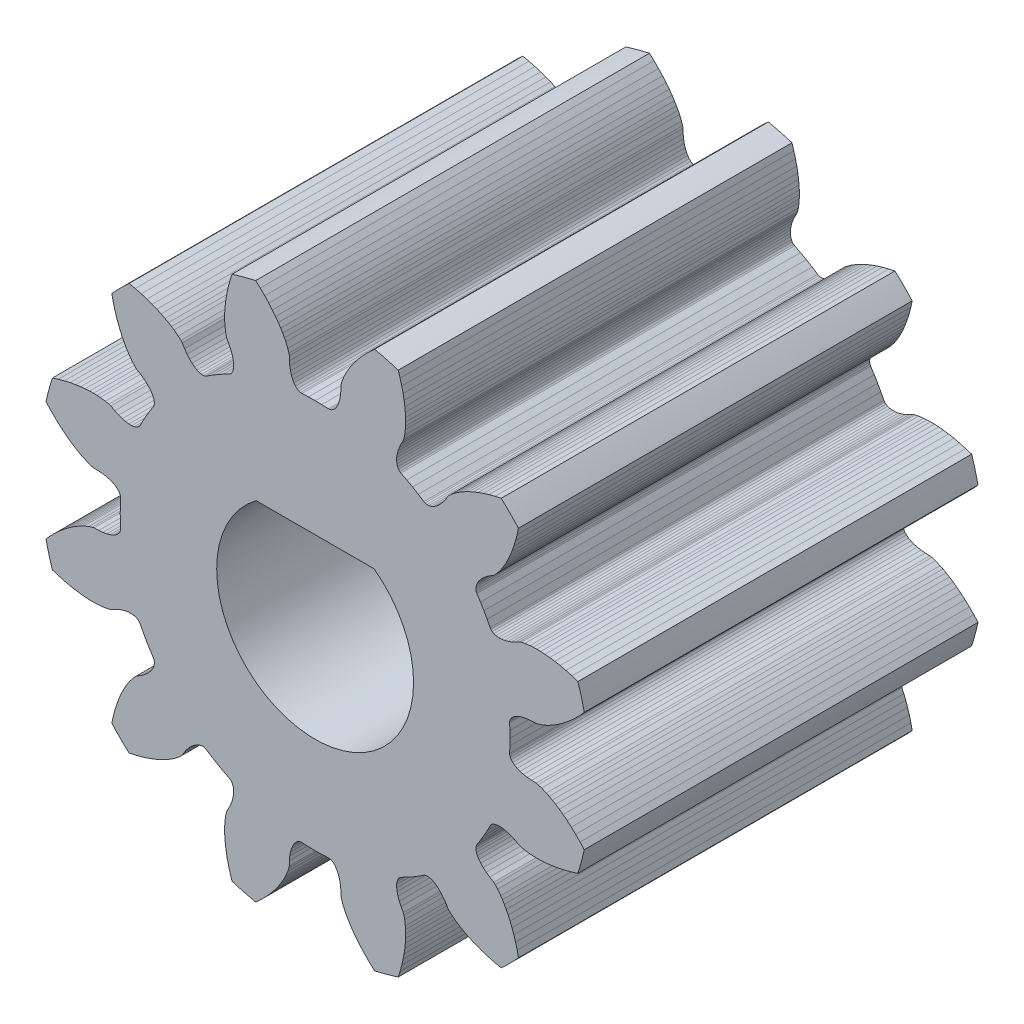
from build123d import *

# Parameters (mm, degrees)
BOSS_EXTRUDE1_DEPTH = 10
SKETCH3_R           = 2.5
CUT_EXTRUDE1_DEPTH  = 40.726722656
SKETCH4_W           = 5.915822746
SKETCH4_H           = 1.691857177
BOSS_EXTRUDE2_DEPTH = 10


with BuildPart() as part:
    # Model → Boss-Extrude1 (new body)
    with BuildSketch(Plane.XY):
        with BuildLine():
            Line((25.8693845, -4.5708333), (25.9097848, -4.4160686))
            Line((25.9097848, -4.4160686), (25.953786, -4.2724809))
            Line((25.953786, -4.2724809), (26.0002786, -4.1407685))
            Line((26.0002786, -4.1407685), (26.0487652, -4.0198098))
            Line((26.0487652, -4.0198098), (26.0976506, -3.9112417))
            Line((26.0976506, -3.9112417), (26.1474591, -3.8119326))
            Line((26.1474591, -3.8119326), (26.1956452, -3.7251533))
            Line((26.1956452, -3.7251533), (26.2429181, -3.6477925))
            Line((26.2429181, -3.6477925), (26.2874834, -3.5813018))
            Line((26.2874834, -3.5813018), (26.3670654, -3.4769619))
            Line((26.3670654, -3.4769619), (26.4284965, -3.4089436))
            Line((26.4284965, -3.4089436), (26.4660329, -3.3745587))
            Line((26.4660329, -3.3745587), (26.5668109, -3.3141113))
            Line((26.5668109, -3.3141113), (26.6546587, -3.2515682))
            Line((26.6546587, -3.2515682), (26.7295821, -3.1879192))
            Line((26.7295821, -3.1879192), (26.7916695, -3.1241177))
            Line((26.7916695, -3.1241177), (26.8410468, -3.0611418))
            Line((26.8410468, -3.0611418), (26.8779217, -2.999911))
            Line((26.8779217, -2.999911), (26.9025353, -2.9413829))
            Line((26.9025353, -2.9413829), (26.9152053, -2.8864481))
            Line((26.9152053, -2.8864481), (26.9162819, -2.8360127))
            Line((26.9162819, -2.8360127), (26.906188, -2.7909297))
            Line((26.906188, -2.7909297), (26.8915643, -2.7611406))
            Line((26.8915643, -2.7611406), (26.8003034, -2.6201521))
            Line((26.8003034, -2.6201521), (26.7131743, -2.475))
            Line((26.7131743, -2.475), (26.6310334, -2.3269679))
            Line((26.6310334, -2.3269679), (26.5545643, -2.1774394))
            Line((26.5545643, -2.1774394), (26.536078, -2.1498803))
            Line((26.536078, -2.1498803), (26.5020819, -2.1185973))
            Line((26.5020819, -2.1185973), (26.4578653, -2.0943119))
            Line((26.4578653, -2.0943119), (26.4039553, -2.0778171))
            Line((26.4039553, -2.0778171), (26.3409617, -2.069869))
            Line((26.3409617, -2.069869), (26.2694968, -2.0711882))
            Line((26.2694968, -2.0711882), (26.1902695, -2.0824623))
            Line((26.1902695, -2.0824623), (26.1039721, -2.1043308))
            Line((26.1039721, -2.1043308), (26.0113887, -2.1373918))
            Line((26.0113887, -2.1373918), (25.9133009, -2.1821987))
            Line((25.9133009, -2.1821987), (25.8105629, -2.2392513))
            Line((25.8105629, -2.2392513), (25.7620165, -2.2545664))
            Line((25.7620165, -2.2545664), (25.6723954, -2.2737581))
            Line((25.6723954, -2.2737581), (25.5422434, -2.2905082))
            Line((25.5422434, -2.2905082), (25.4623781, -2.2958575))
            Line((25.4623781, -2.2958575), (25.3717452, -2.2981167))
            Line((25.3717452, -2.2981167), (25.2724991, -2.2964574))
            Line((25.2724991, -2.2964574), (25.1615906, -2.2899383))
            Line((25.1615906, -2.2899383), (25.0431252, -2.2779902))
            Line((25.0431252, -2.2779902), (24.9141286, -2.2595015))
            Line((24.9141286, -2.2595015), (24.776816, -2.2339091))
            Line((24.776816, -2.2339091), (24.6304648, -2.2002214))
            Line((24.6304648, -2.2002214), (24.4762345, -2.1578267))
            Line((24.4762345, -2.1578267), (24.325472271, -2.109558904))
            ThreePointArc((24.325472271, -2.109558904), (24.23854966, -1.811725181), (24.164909974, -1.510332309))
            Line((24.164909974, -1.510332309), (24.27134, -1.39315))
            Line((24.27134, -1.39315), (24.38371, -1.27932))
            Line((24.38371, -1.27932), (24.49361, -1.17697))
            Line((24.49361, -1.17697), (24.59973, -1.08615))
            Line((24.59973, -1.08615), (24.7022, -1.00564))
            Line((24.7022, -1.00564), (24.79882, -0.93606))
            Line((24.79882, -0.93606), (24.89161, -0.87496))
            Line((24.89161, -0.87496), (24.97673, -0.8239))
            Line((24.97673, -0.8239), (25.05635, -0.78054))
            Line((25.05635, -0.78054), (25.12819, -0.74524))
            Line((25.12819, -0.74524), (25.24928, -0.69467))
            Line((25.24928, -0.69467), (25.33649, -0.66648))
            Line((25.33649, -0.66648), (25.38619, -0.65547))
            Line((25.38619, -0.65547), (25.50369, -0.65351))
            Line((25.50369, -0.65351), (25.61104, -0.64327))
            Line((25.61104, -0.64327), (25.70775, -0.62561))
            Line((25.70775, -0.62561), (25.79342, -0.6014))
            Line((25.79342, -0.6014), (25.86767, -0.57155))
            Line((25.86767, -0.57155), (25.93022, -0.53696))
            Line((25.93022, -0.53696), (25.9808, -0.49858))
            Line((25.9808, -0.49858), (26.01924, -0.45734))
            Line((26.01924, -0.45734), (26.04539, -0.4142))
            Line((26.04539, -0.4142), (26.05919, -0.37011))
            Line((26.05919, -0.37011), (26.06142, -0.337))
            Line((26.06142, -0.337), (26.05288, -0.16927))
            Line((26.05288, -0.16927), (26.05, 0))
            Line((26.05, 0), (26.05288, 0.16927))
            Line((26.05288, 0.16927), (26.06142, 0.337))
            Line((26.06142, 0.337), (26.05919, 0.37011))
            Line((26.05919, 0.37011), (26.04539, 0.4142))
            Line((26.04539, 0.4142), (26.01924, 0.45734))
            Line((26.01924, 0.45734), (25.9808, 0.49858))
            Line((25.9808, 0.49858), (25.93022, 0.53696))
            Line((25.93022, 0.53696), (25.86767, 0.57155))
            Line((25.86767, 0.57155), (25.79342, 0.6014))
            Line((25.79342, 0.6014), (25.70775, 0.62561))
            Line((25.70775, 0.62561), (25.61104, 0.64327))
            Line((25.61104, 0.64327), (25.50369, 0.65351))
            Line((25.50369, 0.65351), (25.38619, 0.65547))
            Line((25.38619, 0.65547), (25.33649, 0.66648))
            Line((25.33649, 0.66648), (25.24928, 0.69467))
            Line((25.24928, 0.69467), (25.12819, 0.74524))
            Line((25.12819, 0.74524), (25.05635, 0.78054))
            Line((25.05635, 0.78054), (24.97673, 0.8239))
            Line((24.97673, 0.8239), (24.89161, 0.87496))
            Line((24.89161, 0.87496), (24.79882, 0.93606))
            Line((24.79882, 0.93606), (24.7022, 1.00564))
            Line((24.7022, 1.00564), (24.59973, 1.08615))
            Line((24.59973, 1.08615), (24.49361, 1.17697))
            Line((24.49361, 1.17697), (24.38371, 1.27932))
            Line((24.38371, 1.27932), (24.27134, 1.39315))
            Line((24.27134, 1.39315), (24.164909974, 1.510332309))
            ThreePointArc((24.164909974, 1.510332309), (24.23854966, 1.811725181), (24.325472271, 2.109558904))
            Line((24.325472271, 2.109558904), (24.4762345, 2.1578267))
            Line((24.4762345, 2.1578267), (24.6304648, 2.2002214))
            Line((24.6304648, 2.2002214), (24.776816, 2.2339091))
            Line((24.776816, 2.2339091), (24.9141286, 2.2595015))
            Line((24.9141286, 2.2595015), (25.0431252, 2.2779902))
            Line((25.0431252, 2.2779902), (25.1615906, 2.2899383))
            Line((25.1615906, 2.2899383), (25.2724991, 2.2964574))
            Line((25.2724991, 2.2964574), (25.3717452, 2.2981167))
            Line((25.3717452, 2.2981167), (25.4623781, 2.2958575))
            Line((25.4623781, 2.2958575), (25.5422434, 2.2905082))
            Line((25.5422434, 2.2905082), (25.6723954, 2.2737581))
            Line((25.6723954, 2.2737581), (25.7620165, 2.2545664))
            Line((25.7620165, 2.2545664), (25.8105629, 2.2392513))
            Line((25.8105629, 2.2392513), (25.9133009, 2.1821987))
            Line((25.9133009, 2.1821987), (26.0113887, 2.1373918))
            Line((26.0113887, 2.1373918), (26.1039721, 2.1043308))
            Line((26.1039721, 2.1043308), (26.1902695, 2.0824623))
            Line((26.1902695, 2.0824623), (26.2694968, 2.0711882))
            Line((26.2694968, 2.0711882), (26.3409617, 2.069869))
            Line((26.3409617, 2.069869), (26.4039553, 2.0778171))
            Line((26.4039553, 2.0778171), (26.4578653, 2.0943119))
            Line((26.4578653, 2.0943119), (26.5020819, 2.1185973))
            Line((26.5020819, 2.1185973), (26.536078, 2.1498803))
            Line((26.536078, 2.1498803), (26.5545643, 2.1774394))
            Line((26.5545643, 2.1774394), (26.6310334, 2.3269679))
            Line((26.6310334, 2.3269679), (26.7131743, 2.475))
            Line((26.7131743, 2.475), (26.8003034, 2.6201521))
            Line((26.8003034, 2.6201521), (26.8915643, 2.7611406))
            Line((26.8915643, 2.7611406), (26.906188, 2.7909297))
            Line((26.906188, 2.7909297), (26.9162819, 2.8360127))
            Line((26.9162819, 2.8360127), (26.9152053, 2.8864481))
            Line((26.9152053, 2.8864481), (26.9025353, 2.9413829))
            Line((26.9025353, 2.9413829), (26.8779217, 2.999911))
            Line((26.8779217, 2.999911), (26.8410468, 3.0611418))
            Line((26.8410468, 3.0611418), (26.7916695, 3.1241177))
            Line((26.7916695, 3.1241177), (26.7295821, 3.1879192))
            Line((26.7295821, 3.1879192), (26.6546587, 3.2515682))
            Line((26.6546587, 3.2515682), (26.5668109, 3.3141113))
            Line((26.5668109, 3.3141113), (26.4660329, 3.3745587))
            Line((26.4660329, 3.3745587), (26.4284965, 3.4089436))
            Line((26.4284965, 3.4089436), (26.3670654, 3.4769619))
            Line((26.3670654, 3.4769619), (26.2874834, 3.5813018))
            Line((26.2874834, 3.5813018), (26.2429181, 3.6477925))
            Line((26.2429181, 3.6477925), (26.1956452, 3.7251533))
            Line((26.1956452, 3.7251533), (26.1474591, 3.8119326))
            Line((26.1474591, 3.8119326), (26.0976506, 3.9112417))
            Line((26.0976506, 3.9112417), (26.0487652, 4.0198098))
            Line((26.0487652, 4.0198098), (26.0002786, 4.1407685))
            Line((26.0002786, 4.1407685), (25.953786, 4.2724809))
            Line((25.953786, 4.2724809), (25.9097848, 4.4160686))
            Line((25.9097848, 4.4160686), (25.8693845, 4.5708333))
            Line((25.8693845, 4.5708333), (25.83580457, 4.725531132))
            ThreePointArc((25.83580457, 4.725531132), (26.050274832, 4.949725168), (26.274468868, 5.16419543))
            Line((26.274468868, 5.16419543), (26.4291667, 5.1306155))
            Line((26.4291667, 5.1306155), (26.5839314, 5.0902152))
            Line((26.5839314, 5.0902152), (26.7275191, 5.046214))
            Line((26.7275191, 5.046214), (26.8592315, 4.9997214))
            Line((26.8592315, 4.9997214), (26.9801902, 4.9512348))
            Line((26.9801902, 4.9512348), (27.0887583, 4.9023494))
            Line((27.0887583, 4.9023494), (27.1880674, 4.8525409))
            Line((27.1880674, 4.8525409), (27.2748467, 4.8043548))
            Line((27.2748467, 4.8043548), (27.3522075, 4.7570819))
            Line((27.3522075, 4.7570819), (27.4186982, 4.7125166))
            Line((27.4186982, 4.7125166), (27.5230381, 4.6329346))
            Line((27.5230381, 4.6329346), (27.5910564, 4.5715035))
            Line((27.5910564, 4.5715035), (27.6254413, 4.5339671))
            Line((27.6254413, 4.5339671), (27.6858887, 4.4331891))
            Line((27.6858887, 4.4331891), (27.7484318, 4.3453413))
            Line((27.7484318, 4.3453413), (27.8120808, 4.2704179))
            Line((27.8120808, 4.2704179), (27.8758823, 4.2083305))
            Line((27.8758823, 4.2083305), (27.9388582, 4.1589532))
            Line((27.9388582, 4.1589532), (28.000089, 4.1220783))
            Line((28.000089, 4.1220783), (28.0586171, 4.0974647))
            Line((28.0586171, 4.0974647), (28.1135519, 4.0847947))
            Line((28.1135519, 4.0847947), (28.1639873, 4.0837181))
            Line((28.1639873, 4.0837181), (28.2090703, 4.093812))
            Line((28.2090703, 4.093812), (28.2388594, 4.1084357))
            Line((28.2388594, 4.1084357), (28.3798479, 4.1996966))
            Line((28.3798479, 4.1996966), (28.525, 4.2868257))
            Line((28.525, 4.2868257), (28.6730321, 4.3689666))
            Line((28.6730321, 4.3689666), (28.8225606, 4.4454357))
            Line((28.8225606, 4.4454357), (28.8501197, 4.463922))
            Line((28.8501197, 4.463922), (28.8814027, 4.4979181))
            Line((28.8814027, 4.4979181), (28.9056881, 4.5421347))
            Line((28.9056881, 4.5421347), (28.9221829, 4.5960447))
            Line((28.9221829, 4.5960447), (28.930131, 4.6590383))
            Line((28.930131, 4.6590383), (28.9288118, 4.7305032))
            Line((28.9288118, 4.7305032), (28.9175377, 4.8097305))
            Line((28.9175377, 4.8097305), (28.8956692, 4.8960279))
            Line((28.8956692, 4.8960279), (28.8626082, 4.9886113))
            Line((28.8626082, 4.9886113), (28.8178013, 5.0866991))
            Line((28.8178013, 5.0866991), (28.7607487, 5.1894371))
            Line((28.7607487, 5.1894371), (28.7454336, 5.2379835))
            Line((28.7454336, 5.2379835), (28.7262419, 5.3276046))
            Line((28.7262419, 5.3276046), (28.7094918, 5.4577566))
            Line((28.7094918, 5.4577566), (28.7041425, 5.5376219))
            Line((28.7041425, 5.5376219), (28.7018833, 5.6282548))
            Line((28.7018833, 5.6282548), (28.7035426, 5.7275009))
            Line((28.7035426, 5.7275009), (28.7100617, 5.8384094))
            Line((28.7100617, 5.8384094), (28.7220098, 5.9568748))
            Line((28.7220098, 5.9568748), (28.7404985, 6.0858714))
            Line((28.7404985, 6.0858714), (28.7660909, 6.223184))
            Line((28.7660909, 6.223184), (28.7997786, 6.3695352))
            Line((28.7997786, 6.3695352), (28.8421733, 6.5237655))
            Line((28.8421733, 6.5237655), (28.890441096, 6.674527729))
            ThreePointArc((28.890441096, 6.674527729), (29.188274819, 6.76145034), (29.489667691, 6.835090026))
            Line((29.489667691, 6.835090026), (29.60685, 6.72866))
            Line((29.60685, 6.72866), (29.72068, 6.61629))
            Line((29.72068, 6.61629), (29.82303, 6.50639))
            Line((29.82303, 6.50639), (29.91385, 6.40027))
            Line((29.91385, 6.40027), (29.99436, 6.2978))
            Line((29.99436, 6.2978), (30.06394, 6.20118))
            Line((30.06394, 6.20118), (30.12504, 6.10839))
            Line((30.12504, 6.10839), (30.1761, 6.02327))
            Line((30.1761, 6.02327), (30.21946, 5.94365))
            Line((30.21946, 5.94365), (30.25476, 5.87181))
            Line((30.25476, 5.87181), (30.30533, 5.75072))
            Line((30.30533, 5.75072), (30.33352, 5.66351))
            Line((30.33352, 5.66351), (30.34453, 5.61381))
            Line((30.34453, 5.61381), (30.34649, 5.49631))
            Line((30.34649, 5.49631), (30.35673, 5.38896))
            Line((30.35673, 5.38896), (30.37439, 5.29225))
            Line((30.37439, 5.29225), (30.3986, 5.20658))
            Line((30.3986, 5.20658), (30.42845, 5.13233))
            Line((30.42845, 5.13233), (30.46304, 5.06978))
            Line((30.46304, 5.06978), (30.50142, 5.0192))
            Line((30.50142, 5.0192), (30.54266, 4.98076))
            Line((30.54266, 4.98076), (30.5858, 4.95461))
            Line((30.5858, 4.95461), (30.62989, 4.94081))
            Line((30.62989, 4.94081), (30.663, 4.93858))
            Line((30.663, 4.93858), (30.83073, 4.94712))
            Line((30.83073, 4.94712), (31, 4.95))
            Line((31, 4.95), (31.16927, 4.94712))
            Line((31.16927, 4.94712), (31.337, 4.93858))
            Line((31.337, 4.93858), (31.37011, 4.94081))
            Line((31.37011, 4.94081), (31.4142, 4.95461))
            Line((31.4142, 4.95461), (31.45734, 4.98076))
            Line((31.45734, 4.98076), (31.49858, 5.0192))
            Line((31.49858, 5.0192), (31.53696, 5.06978))
            Line((31.53696, 5.06978), (31.57155, 5.13233))
            Line((31.57155, 5.13233), (31.6014, 5.20658))
            Line((31.6014, 5.20658), (31.62561, 5.29225))
            Line((31.62561, 5.29225), (31.64327, 5.38896))
            Line((31.64327, 5.38896), (31.65351, 5.49631))
            Line((31.65351, 5.49631), (31.65547, 5.61381))
            Line((31.65547, 5.61381), (31.66648, 5.66351))
            Line((31.66648, 5.66351), (31.69467, 5.75072))
            Line((31.69467, 5.75072), (31.74524, 5.87181))
            Line((31.74524, 5.87181), (31.78054, 5.94365))
            Line((31.78054, 5.94365), (31.8239, 6.02327))
            Line((31.8239, 6.02327), (31.87496, 6.10839))
            Line((31.87496, 6.10839), (31.93606, 6.20118))
            Line((31.93606, 6.20118), (32.00564, 6.2978))
            Line((32.00564, 6.2978), (32.08615, 6.40027))
            Line((32.08615, 6.40027), (32.17697, 6.50639))
            Line((32.17697, 6.50639), (32.27932, 6.61629))
            Line((32.27932, 6.61629), (32.39315, 6.72866))
            Line((32.39315, 6.72866), (32.510332309, 6.835090026))
            ThreePointArc((32.510332309, 6.835090026), (32.811725181, 6.76145034), (33.109558904, 6.674527729))
            Line((33.109558904, 6.674527729), (33.1578267, 6.5237655))
            Line((33.1578267, 6.5237655), (33.2002214, 6.3695352))
            Line((33.2002214, 6.3695352), (33.2339091, 6.223184))
            Line((33.2339091, 6.223184), (33.2595015, 6.0858714))
            Line((33.2595015, 6.0858714), (33.2779902, 5.9568748))
            Line((33.2779902, 5.9568748), (33.2899383, 5.8384094))
            Line((33.2899383, 5.8384094), (33.2964574, 5.7275009))
            Line((33.2964574, 5.7275009), (33.2981167, 5.6282548))
            Line((33.2981167, 5.6282548), (33.2958575, 5.5376219))
            Line((33.2958575, 5.5376219), (33.2905082, 5.4577566))
            Line((33.2905082, 5.4577566), (33.2737581, 5.3276046))
            Line((33.2737581, 5.3276046), (33.2545664, 5.2379835))
            Line((33.2545664, 5.2379835), (33.2392513, 5.1894371))
            Line((33.2392513, 5.1894371), (33.1821987, 5.0866991))
            Line((33.1821987, 5.0866991), (33.1373918, 4.9886113))
            Line((33.1373918, 4.9886113), (33.1043308, 4.8960279))
            Line((33.1043308, 4.8960279), (33.0824623, 4.8097305))
            Line((33.0824623, 4.8097305), (33.0711882, 4.7305032))
            Line((33.0711882, 4.7305032), (33.069869, 4.6590383))
            Line((33.069869, 4.6590383), (33.0778171, 4.5960447))
            Line((33.0778171, 4.5960447), (33.0943119, 4.5421347))
            Line((33.0943119, 4.5421347), (33.1185973, 4.4979181))
            Line((33.1185973, 4.4979181), (33.1498803, 4.463922))
            Line((33.1498803, 4.463922), (33.1774394, 4.4454357))
            Line((33.1774394, 4.4454357), (33.3269679, 4.3689666))
            Line((33.3269679, 4.3689666), (33.475, 4.2868257))
            Line((33.475, 4.2868257), (33.6201521, 4.1996966))
            Line((33.6201521, 4.1996966), (33.7611406, 4.1084357))
            Line((33.7611406, 4.1084357), (33.7909297, 4.093812))
            Line((33.7909297, 4.093812), (33.8360127, 4.0837181))
            Line((33.8360127, 4.0837181), (33.8864481, 4.0847947))
            Line((33.8864481, 4.0847947), (33.9413829, 4.0974647))
            Line((33.9413829, 4.0974647), (33.999911, 4.1220783))
            Line((33.999911, 4.1220783), (34.0611418, 4.1589532))
            Line((34.0611418, 4.1589532), (34.1241177, 4.2083305))
            Line((34.1241177, 4.2083305), (34.1879192, 4.2704179))
            Line((34.1879192, 4.2704179), (34.2515682, 4.3453413))
            Line((34.2515682, 4.3453413), (34.3141113, 4.4331891))
            Line((34.3141113, 4.4331891), (34.3745587, 4.5339671))
            Line((34.3745587, 4.5339671), (34.4089436, 4.5715035))
            Line((34.4089436, 4.5715035), (34.4769619, 4.6329346))
            Line((34.4769619, 4.6329346), (34.5813018, 4.7125166))
            Line((34.5813018, 4.7125166), (34.6477925, 4.7570819))
            Line((34.6477925, 4.7570819), (34.7251533, 4.8043548))
            Line((34.7251533, 4.8043548), (34.8119326, 4.8525409))
            Line((34.8119326, 4.8525409), (34.9112417, 4.9023494))
            Line((34.9112417, 4.9023494), (35.0198098, 4.9512348))
            Line((35.0198098, 4.9512348), (35.1407685, 4.9997214))
            Line((35.1407685, 4.9997214), (35.2724809, 5.046214))
            Line((35.2724809, 5.046214), (35.4160686, 5.0902152))
            Line((35.4160686, 5.0902152), (35.5708333, 5.1306155))
            Line((35.5708333, 5.1306155), (35.725531132, 5.16419543))
            ThreePointArc((35.725531132, 5.16419543), (35.949725168, 4.949725168), (36.16419543, 4.725531132))
            Line((36.16419543, 4.725531132), (36.1306155, 4.5708333))
            Line((36.1306155, 4.5708333), (36.0902152, 4.4160686))
            Line((36.0902152, 4.4160686), (36.046214, 4.2724809))
            Line((36.046214, 4.2724809), (35.9997214, 4.1407685))
            Line((35.9997214, 4.1407685), (35.9512348, 4.0198098))
            Line((35.9512348, 4.0198098), (35.9023494, 3.9112417))
            Line((35.9023494, 3.9112417), (35.8525409, 3.8119326))
            Line((35.8525409, 3.8119326), (35.8043548, 3.7251533))
            Line((35.8043548, 3.7251533), (35.7570819, 3.6477925))
            Line((35.7570819, 3.6477925), (35.7125166, 3.5813018))
            Line((35.7125166, 3.5813018), (35.6329346, 3.4769619))
            Line((35.6329346, 3.4769619), (35.5715035, 3.4089436))
            Line((35.5715035, 3.4089436), (35.5339671, 3.3745587))
            Line((35.5339671, 3.3745587), (35.4331891, 3.3141113))
            Line((35.4331891, 3.3141113), (35.3453413, 3.2515682))
            Line((35.3453413, 3.2515682), (35.2704179, 3.1879192))
            Line((35.2704179, 3.1879192), (35.2083305, 3.1241177))
            Line((35.2083305, 3.1241177), (35.1589532, 3.0611418))
            Line((35.1589532, 3.0611418), (35.1220783, 2.999911))
            Line((35.1220783, 2.999911), (35.0974647, 2.9413829))
            Line((35.0974647, 2.9413829), (35.0847947, 2.8864481))
            Line((35.0847947, 2.8864481), (35.0837181, 2.8360127))
            Line((35.0837181, 2.8360127), (35.093812, 2.7909297))
            Line((35.093812, 2.7909297), (35.1084357, 2.7611406))
            Line((35.1084357, 2.7611406), (35.1996966, 2.6201521))
            Line((35.1996966, 2.6201521), (35.2868257, 2.475))
            Line((35.2868257, 2.475), (35.3689666, 2.3269679))
            Line((35.3689666, 2.3269679), (35.4454357, 2.1774394))
            Line((35.4454357, 2.1774394), (35.463922, 2.1498803))
            Line((35.463922, 2.1498803), (35.4979181, 2.1185973))
            Line((35.4979181, 2.1185973), (35.5421347, 2.0943119))
            Line((35.5421347, 2.0943119), (35.5960447, 2.0778171))
            Line((35.5960447, 2.0778171), (35.6590383, 2.069869))
            Line((35.6590383, 2.069869), (35.7305032, 2.0711882))
            Line((35.7305032, 2.0711882), (35.8097305, 2.0824623))
            Line((35.8097305, 2.0824623), (35.8960279, 2.1043308))
            Line((35.8960279, 2.1043308), (35.9886113, 2.1373918))
            Line((35.9886113, 2.1373918), (36.0866991, 2.1821987))
            Line((36.0866991, 2.1821987), (36.1894371, 2.2392513))
            Line((36.1894371, 2.2392513), (36.2379835, 2.2545664))
            Line((36.2379835, 2.2545664), (36.3276046, 2.2737581))
            Line((36.3276046, 2.2737581), (36.4577566, 2.2905082))
            Line((36.4577566, 2.2905082), (36.5376219, 2.2958575))
            Line((36.5376219, 2.2958575), (36.6282548, 2.2981167))
            Line((36.6282548, 2.2981167), (36.7275009, 2.2964574))
            Line((36.7275009, 2.2964574), (36.8384094, 2.2899383))
            Line((36.8384094, 2.2899383), (36.9568748, 2.2779902))
            Line((36.9568748, 2.2779902), (37.0858714, 2.2595015))
            Line((37.0858714, 2.2595015), (37.223184, 2.2339091))
            Line((37.223184, 2.2339091), (37.3695352, 2.2002214))
            Line((37.3695352, 2.2002214), (37.5237655, 2.1578267))
            Line((37.5237655, 2.1578267), (37.674527729, 2.109558904))
            ThreePointArc((37.674527729, 2.109558904), (37.76145034, 1.811725181), (37.835090026, 1.510332309))
            Line((37.835090026, 1.510332309), (37.72866, 1.39315))
            Line((37.72866, 1.39315), (37.61629, 1.27932))
            Line((37.61629, 1.27932), (37.50639, 1.17697))
            Line((37.50639, 1.17697), (37.40027, 1.08615))
            Line((37.40027, 1.08615), (37.2978, 1.00564))
            Line((37.2978, 1.00564), (37.20118, 0.93606))
            Line((37.20118, 0.93606), (37.10839, 0.87496))
            Line((37.10839, 0.87496), (37.02327, 0.8239))
            Line((37.02327, 0.8239), (36.94365, 0.78054))
            Line((36.94365, 0.78054), (36.87181, 0.74524))
            Line((36.87181, 0.74524), (36.75072, 0.69467))
            Line((36.75072, 0.69467), (36.66351, 0.66648))
            Line((36.66351, 0.66648), (36.61381, 0.65547))
            Line((36.61381, 0.65547), (36.49631, 0.65351))
            Line((36.49631, 0.65351), (36.38896, 0.64327))
            Line((36.38896, 0.64327), (36.29225, 0.62561))
            Line((36.29225, 0.62561), (36.20658, 0.6014))
            Line((36.20658, 0.6014), (36.13233, 0.57155))
            Line((36.13233, 0.57155), (36.06978, 0.53696))
            Line((36.06978, 0.53696), (36.0192, 0.49858))
            Line((36.0192, 0.49858), (35.98076, 0.45734))
            Line((35.98076, 0.45734), (35.95461, 0.4142))
            Line((35.95461, 0.4142), (35.94081, 0.37011))
            Line((35.94081, 0.37011), (35.93858, 0.337))
            Line((35.93858, 0.337), (35.94712, 0.16927))
            Line((35.94712, 0.16927), (35.95, 0))
            Line((35.95, 0), (35.94712, -0.16927))
            Line((35.94712, -0.16927), (35.93858, -0.337))
            Line((35.93858, -0.337), (35.94081, -0.37011))
            Line((35.94081, -0.37011), (35.95461, -0.4142))
            Line((35.95461, -0.4142), (35.98076, -0.45734))
            Line((35.98076, -0.45734), (36.0192, -0.49858))
            Line((36.0192, -0.49858), (36.06978, -0.53696))
            Line((36.06978, -0.53696), (36.13233, -0.57155))
            Line((36.13233, -0.57155), (36.20658, -0.6014))
            Line((36.20658, -0.6014), (36.29225, -0.62561))
            Line((36.29225, -0.62561), (36.38896, -0.64327))
            Line((36.38896, -0.64327), (36.49631, -0.65351))
            Line((36.49631, -0.65351), (36.61381, -0.65547))
            Line((36.61381, -0.65547), (36.66351, -0.66648))
            Line((36.66351, -0.66648), (36.75072, -0.69467))
            Line((36.75072, -0.69467), (36.87181, -0.74524))
            Line((36.87181, -0.74524), (36.94365, -0.78054))
            Line((36.94365, -0.78054), (37.02327, -0.8239))
            Line((37.02327, -0.8239), (37.10839, -0.87496))
            Line((37.10839, -0.87496), (37.20118, -0.93606))
            Line((37.20118, -0.93606), (37.2978, -1.00564))
            Line((37.2978, -1.00564), (37.40027, -1.08615))
            Line((37.40027, -1.08615), (37.50639, -1.17697))
            Line((37.50639, -1.17697), (37.61629, -1.27932))
            Line((37.61629, -1.27932), (37.72866, -1.39315))
            Line((37.72866, -1.39315), (37.835090026, -1.510332309))
            ThreePointArc((37.835090026, -1.510332309), (37.76145034, -1.811725181), (37.674527729, -2.109558904))
            Line((37.674527729, -2.109558904), (37.5237655, -2.1578267))
            Line((37.5237655, -2.1578267), (37.3695352, -2.2002214))
            Line((37.3695352, -2.2002214), (37.223184, -2.2339091))
            Line((37.223184, -2.2339091), (37.0858714, -2.2595015))
            Line((37.0858714, -2.2595015), (36.9568748, -2.2779902))
            Line((36.9568748, -2.2779902), (36.8384094, -2.2899383))
            Line((36.8384094, -2.2899383), (36.7275009, -2.2964574))
            Line((36.7275009, -2.2964574), (36.6282548, -2.2981167))
            Line((36.6282548, -2.2981167), (36.5376219, -2.2958575))
            Line((36.5376219, -2.2958575), (36.4577566, -2.2905082))
            Line((36.4577566, -2.2905082), (36.3276046, -2.2737581))
            Line((36.3276046, -2.2737581), (36.2379835, -2.2545664))
            Line((36.2379835, -2.2545664), (36.1894371, -2.2392513))
            Line((36.1894371, -2.2392513), (36.0866991, -2.1821987))
            Line((36.0866991, -2.1821987), (35.9886113, -2.1373918))
            Line((35.9886113, -2.1373918), (35.8960279, -2.1043308))
            Line((35.8960279, -2.1043308), (35.8097305, -2.0824623))
            Line((35.8097305, -2.0824623), (35.7305032, -2.0711882))
            Line((35.7305032, -2.0711882), (35.6590383, -2.069869))
            Line((35.6590383, -2.069869), (35.5960447, -2.0778171))
            Line((35.5960447, -2.0778171), (35.5421347, -2.0943119))
            Line((35.5421347, -2.0943119), (35.4979181, -2.1185973))
            Line((35.4979181, -2.1185973), (35.463922, -2.1498803))
            Line((35.463922, -2.1498803), (35.4454357, -2.1774394))
            Line((35.4454357, -2.1774394), (35.3689666, -2.3269679))
            Line((35.3689666, -2.3269679), (35.2868257, -2.475))
            Line((35.2868257, -2.475), (35.1996966, -2.6201521))
            Line((35.1996966, -2.6201521), (35.1084357, -2.7611406))
            Line((35.1084357, -2.7611406), (35.093812, -2.7909297))
            Line((35.093812, -2.7909297), (35.0837181, -2.8360127))
            Line((35.0837181, -2.8360127), (35.0847947, -2.8864481))
            Line((35.0847947, -2.8864481), (35.0974647, -2.9413829))
            Line((35.0974647, -2.9413829), (35.1220783, -2.999911))
            Line((35.1220783, -2.999911), (35.1589532, -3.0611418))
            Line((35.1589532, -3.0611418), (35.2083305, -3.1241177))
            Line((35.2083305, -3.1241177), (35.2704179, -3.1879192))
            Line((35.2704179, -3.1879192), (35.3453413, -3.2515682))
            Line((35.3453413, -3.2515682), (35.4331891, -3.3141113))
            Line((35.4331891, -3.3141113), (35.5339671, -3.3745587))
            Line((35.5339671, -3.3745587), (35.5715035, -3.4089436))
            Line((35.5715035, -3.4089436), (35.6329346, -3.4769619))
            Line((35.6329346, -3.4769619), (35.7125166, -3.5813018))
            Line((35.7125166, -3.5813018), (35.7570819, -3.6477925))
            Line((35.7570819, -3.6477925), (35.8043548, -3.7251533))
            Line((35.8043548, -3.7251533), (35.8525409, -3.8119326))
            Line((35.8525409, -3.8119326), (35.9023494, -3.9112417))
            Line((35.9023494, -3.9112417), (35.9512348, -4.0198098))
            Line((35.9512348, -4.0198098), (35.9997214, -4.1407685))
            Line((35.9997214, -4.1407685), (36.046214, -4.2724809))
            Line((36.046214, -4.2724809), (36.0902152, -4.4160686))
            Line((36.0902152, -4.4160686), (36.1306155, -4.5708333))
            Line((36.1306155, -4.5708333), (36.16419543, -4.725531132))
            ThreePointArc((36.16419543, -4.725531132), (35.949725168, -4.949725168), (35.725531132, -5.16419543))
            Line((35.725531132, -5.16419543), (35.5708333, -5.1306155))
            Line((35.5708333, -5.1306155), (35.4160686, -5.0902152))
            Line((35.4160686, -5.0902152), (35.2724809, -5.046214))
            Line((35.2724809, -5.046214), (35.1407685, -4.9997214))
            Line((35.1407685, -4.9997214), (35.0198098, -4.9512348))
            Line((35.0198098, -4.9512348), (34.9112417, -4.9023494))
            Line((34.9112417, -4.9023494), (34.8119326, -4.8525409))
            Line((34.8119326, -4.8525409), (34.7251533, -4.8043548))
            Line((34.7251533, -4.8043548), (34.6477925, -4.7570819))
            Line((34.6477925, -4.7570819), (34.5813018, -4.7125166))
            Line((34.5813018, -4.7125166), (34.4769619, -4.6329346))
            Line((34.4769619, -4.6329346), (34.4089436, -4.5715035))
            Line((34.4089436, -4.5715035), (34.3745587, -4.5339671))
            Line((34.3745587, -4.5339671), (34.3141113, -4.4331891))
            Line((34.3141113, -4.4331891), (34.2515682, -4.3453413))
            Line((34.2515682, -4.3453413), (34.1879192, -4.2704179))
            Line((34.1879192, -4.2704179), (34.1241177, -4.2083305))
            Line((34.1241177, -4.2083305), (34.0611418, -4.1589532))
            Line((34.0611418, -4.1589532), (33.999911, -4.1220783))
            Line((33.999911, -4.1220783), (33.9413829, -4.0974647))
            Line((33.9413829, -4.0974647), (33.8864481, -4.0847947))
            Line((33.8864481, -4.0847947), (33.8360127, -4.0837181))
            Line((33.8360127, -4.0837181), (33.7909297, -4.093812))
            Line((33.7909297, -4.093812), (33.7611406, -4.1084357))
            Line((33.7611406, -4.1084357), (33.6201521, -4.1996966))
            Line((33.6201521, -4.1996966), (33.475, -4.2868257))
            Line((33.475, -4.2868257), (33.3269679, -4.3689666))
            Line((33.3269679, -4.3689666), (33.1774394, -4.4454357))
            Line((33.1774394, -4.4454357), (33.1498803, -4.463922))
            Line((33.1498803, -4.463922), (33.1185973, -4.4979181))
            Line((33.1185973, -4.4979181), (33.0943119, -4.5421347))
            Line((33.0943119, -4.5421347), (33.0778171, -4.5960447))
            Line((33.0778171, -4.5960447), (33.069869, -4.6590383))
            Line((33.069869, -4.6590383), (33.0711882, -4.7305032))
            Line((33.0711882, -4.7305032), (33.0824623, -4.8097305))
            Line((33.0824623, -4.8097305), (33.1043308, -4.8960279))
            Line((33.1043308, -4.8960279), (33.1373918, -4.9886113))
            Line((33.1373918, -4.9886113), (33.1821987, -5.0866991))
            Line((33.1821987, -5.0866991), (33.2392513, -5.1894371))
            Line((33.2392513, -5.1894371), (33.2545664, -5.2379835))
            Line((33.2545664, -5.2379835), (33.2737581, -5.3276046))
            Line((33.2737581, -5.3276046), (33.2905082, -5.4577566))
            Line((33.2905082, -5.4577566), (33.2958575, -5.5376219))
            Line((33.2958575, -5.5376219), (33.2981167, -5.6282548))
            Line((33.2981167, -5.6282548), (33.2964574, -5.7275009))
            Line((33.2964574, -5.7275009), (33.2899383, -5.8384094))
            Line((33.2899383, -5.8384094), (33.2779902, -5.9568748))
            Line((33.2779902, -5.9568748), (33.2595015, -6.0858714))
            Line((33.2595015, -6.0858714), (33.2339091, -6.223184))
            Line((33.2339091, -6.223184), (33.2002214, -6.3695352))
            Line((33.2002214, -6.3695352), (33.1578267, -6.5237655))
            Line((33.1578267, -6.5237655), (33.109558904, -6.674527729))
            ThreePointArc((33.109558904, -6.674527729), (32.811725181, -6.76145034), (32.510332309, -6.835090026))
            Line((32.510332309, -6.835090026), (32.39315, -6.72866))
            Line((32.39315, -6.72866), (32.27932, -6.61629))
            Line((32.27932, -6.61629), (32.17697, -6.50639))
            Line((32.17697, -6.50639), (32.08615, -6.40027))
            Line((32.08615, -6.40027), (32.00564, -6.2978))
            Line((32.00564, -6.2978), (31.93606, -6.20118))
            Line((31.93606, -6.20118), (31.87496, -6.10839))
            Line((31.87496, -6.10839), (31.8239, -6.02327))
            Line((31.8239, -6.02327), (31.78054, -5.94365))
            Line((31.78054, -5.94365), (31.74524, -5.87181))
            Line((31.74524, -5.87181), (31.69467, -5.75072))
            Line((31.69467, -5.75072), (31.66648, -5.66351))
            Line((31.66648, -5.66351), (31.65547, -5.61381))
            Line((31.65547, -5.61381), (31.65351, -5.49631))
            Line((31.65351, -5.49631), (31.64327, -5.38896))
            Line((31.64327, -5.38896), (31.62561, -5.29225))
            Line((31.62561, -5.29225), (31.6014, -5.20658))
            Line((31.6014, -5.20658), (31.57155, -5.13233))
            Line((31.57155, -5.13233), (31.53696, -5.06978))
            Line((31.53696, -5.06978), (31.49858, -5.0192))
            Line((31.49858, -5.0192), (31.45734, -4.98076))
            Line((31.45734, -4.98076), (31.4142, -4.95461))
            Line((31.4142, -4.95461), (31.37011, -4.94081))
            Line((31.37011, -4.94081), (31.337, -4.93858))
            Line((31.337, -4.93858), (31.16927, -4.94712))
            Line((31.16927, -4.94712), (31, -4.95))
            Line((31, -4.95), (30.83073, -4.94712))
            Line((30.83073, -4.94712), (30.663, -4.93858))
            Line((30.663, -4.93858), (30.62989, -4.94081))
            Line((30.62989, -4.94081), (30.5858, -4.95461))
            Line((30.5858, -4.95461), (30.54266, -4.98076))
            Line((30.54266, -4.98076), (30.50142, -5.0192))
            Line((30.50142, -5.0192), (30.46304, -5.06978))
            Line((30.46304, -5.06978), (30.42845, -5.13233))
            Line((30.42845, -5.13233), (30.3986, -5.20658))
            Line((30.3986, -5.20658), (30.37439, -5.29225))
            Line((30.37439, -5.29225), (30.35673, -5.38896))
            Line((30.35673, -5.38896), (30.34649, -5.49631))
            Line((30.34649, -5.49631), (30.34453, -5.61381))
            Line((30.34453, -5.61381), (30.33352, -5.66351))
            Line((30.33352, -5.66351), (30.30533, -5.75072))
            Line((30.30533, -5.75072), (30.25476, -5.87181))
            Line((30.25476, -5.87181), (30.21946, -5.94365))
            Line((30.21946, -5.94365), (30.1761, -6.02327))
            Line((30.1761, -6.02327), (30.12504, -6.10839))
            Line((30.12504, -6.10839), (30.06394, -6.20118))
            Line((30.06394, -6.20118), (29.99436, -6.2978))
            Line((29.99436, -6.2978), (29.91385, -6.40027))
            Line((29.91385, -6.40027), (29.82303, -6.50639))
            Line((29.82303, -6.50639), (29.72068, -6.61629))
            Line((29.72068, -6.61629), (29.60685, -6.72866))
            Line((29.60685, -6.72866), (29.489667691, -6.835090026))
            ThreePointArc((29.489667691, -6.835090026), (29.188274819, -6.76145034), (28.890441096, -6.674527729))
            Line((28.890441096, -6.674527729), (28.8421733, -6.5237655))
            Line((28.8421733, -6.5237655), (28.7997786, -6.3695352))
            Line((28.7997786, -6.3695352), (28.7660909, -6.223184))
            Line((28.7660909, -6.223184), (28.7404985, -6.0858714))
            Line((28.7404985, -6.0858714), (28.7220098, -5.9568748))
            Line((28.7220098, -5.9568748), (28.7100617, -5.8384094))
            Line((28.7100617, -5.8384094), (28.7035426, -5.7275009))
            Line((28.7035426, -5.7275009), (28.7018833, -5.6282548))
            Line((28.7018833, -5.6282548), (28.7041425, -5.5376219))
            Line((28.7041425, -5.5376219), (28.7094918, -5.4577566))
            Line((28.7094918, -5.4577566), (28.7262419, -5.3276046))
            Line((28.7262419, -5.3276046), (28.7454336, -5.2379835))
            Line((28.7454336, -5.2379835), (28.7607487, -5.1894371))
            Line((28.7607487, -5.1894371), (28.8178013, -5.0866991))
            Line((28.8178013, -5.0866991), (28.8626082, -4.9886113))
            Line((28.8626082, -4.9886113), (28.8956692, -4.8960279))
            Line((28.8956692, -4.8960279), (28.9175377, -4.8097305))
            Line((28.9175377, -4.8097305), (28.9288118, -4.7305032))
            Line((28.9288118, -4.7305032), (28.930131, -4.6590383))
            Line((28.930131, -4.6590383), (28.9221829, -4.5960447))
            Line((28.9221829, -4.5960447), (28.9056881, -4.5421347))
            Line((28.9056881, -4.5421347), (28.8814027, -4.4979181))
            Line((28.8814027, -4.4979181), (28.8501197, -4.463922))
            Line((28.8501197, -4.463922), (28.8225606, -4.4454357))
            Line((28.8225606, -4.4454357), (28.6730321, -4.3689666))
            Line((28.6730321, -4.3689666), (28.525, -4.2868257))
            Line((28.525, -4.2868257), (28.3798479, -4.1996966))
            Line((28.3798479, -4.1996966), (28.2388594, -4.1084357))
            Line((28.2388594, -4.1084357), (28.2090703, -4.093812))
            Line((28.2090703, -4.093812), (28.1639873, -4.0837181))
            Line((28.1639873, -4.0837181), (28.1135519, -4.0847947))
            Line((28.1135519, -4.0847947), (28.0586171, -4.0974647))
            Line((28.0586171, -4.0974647), (28.000089, -4.1220783))
            Line((28.000089, -4.1220783), (27.9388582, -4.1589532))
            Line((27.9388582, -4.1589532), (27.8758823, -4.2083305))
            Line((27.8758823, -4.2083305), (27.8120808, -4.2704179))
            Line((27.8120808, -4.2704179), (27.7484318, -4.3453413))
            Line((27.7484318, -4.3453413), (27.6858887, -4.4331891))
            Line((27.6858887, -4.4331891), (27.6254413, -4.5339671))
            Line((27.6254413, -4.5339671), (27.5910564, -4.5715035))
            Line((27.5910564, -4.5715035), (27.5230381, -4.6329346))
            Line((27.5230381, -4.6329346), (27.4186982, -4.7125166))
            Line((27.4186982, -4.7125166), (27.3522075, -4.7570819))
            Line((27.3522075, -4.7570819), (27.2748467, -4.8043548))
            Line((27.2748467, -4.8043548), (27.1880674, -4.8525409))
            Line((27.1880674, -4.8525409), (27.0887583, -4.9023494))
            Line((27.0887583, -4.9023494), (26.9801902, -4.9512348))
            Line((26.9801902, -4.9512348), (26.8592315, -4.9997214))
            Line((26.8592315, -4.9997214), (26.7275191, -5.046214))
            Line((26.7275191, -5.046214), (26.5839314, -5.0902152))
            Line((26.5839314, -5.0902152), (26.4291667, -5.1306155))
            Line((26.4291667, -5.1306155), (26.274468868, -5.16419543))
            ThreePointArc((26.274468868, -5.16419543), (26.050274832, -4.949725168), (25.83580457, -4.725531132))
            Line((25.83580457, -4.725531132), (25.8693845, -4.5708333))
        make_face()
    extrude(amount=BOSS_EXTRUDE1_DEPTH)

    # Sketch3 → Cut-Extrude1 (cut, through all)
    with BuildSketch(Plane.XY.offset(10)):
        with Locations((31, 0)):
            Circle(SKETCH3_R)
    extrude(amount=-CUT_EXTRUDE1_DEPTH, mode=Mode.SUBTRACT)

    # Sketch4 → Boss-Extrude2 (add)
    with BuildSketch(Plane.XY.offset(10)):
        with Locations((31.005677373, 2.845928589)):
            Rectangle(SKETCH4_W, SKETCH4_H)
    extrude(amount=-BOSS_EXTRUDE2_DEPTH)


solid = part.part
